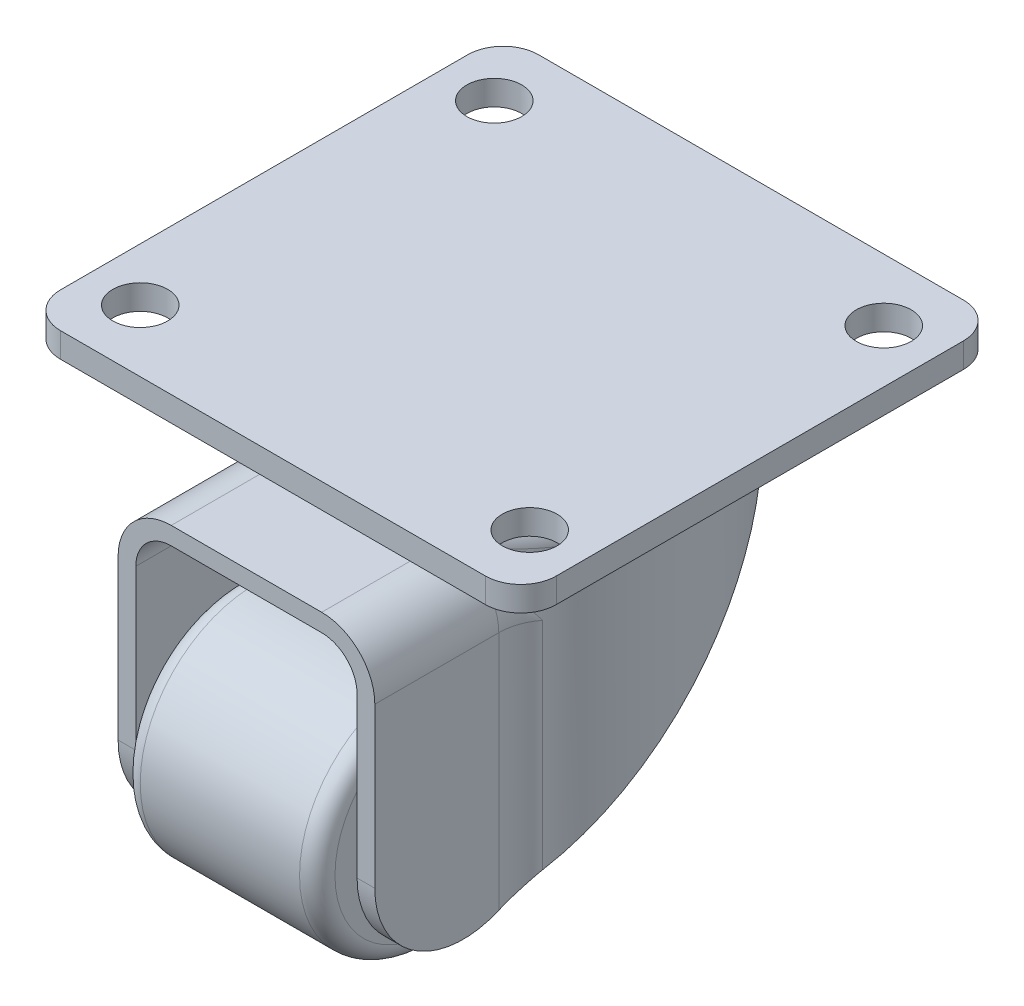
from build123d import *

# Parameters (mm, degrees)
SKETCH1_W               = 28
SKETCH1_H               = 27
BOSS_EXTRUDE1_DEPTH     = 1.4
SKETCH2_R               = 1.55
CUT_EXTRUDE1_DEPTH      = 20.498974332
FILLET1_R               = 2
FILLET2_R               = 2
BOSS_EXTRUDE2_DEPTH     = 20
SKETCH5_W               = 14.5
SKETCH5_H               = 1
BOSS_EXTRUDE3_DEPTH     = 20
FILLET3_R               = 4
FILLET4_R               = 3
CUT_EXTRUDE2_DEPTH      = 32.957002439
CUT_EXTRUDE2_DEPTH_BACK = 32.957002439
FILLET6_R               = 2
FILLET7_R               = 3
SKETCH7_R               = 1.25
BOSS_EXTRUDE4_DEPTH     = 14.5
SKETCH8_R               = 6.5
BOSS_EXTRUDE5_DEPTH     = 5.5
FILLET8_R               = 1


with BuildPart() as part:
    # Sketch1 → Boss-Extrude1 (new body)
    with BuildSketch(Plane(origin=(0, 0, 0), x_dir=(1, 0, 0), z_dir=(0, 1, 0))):
        Rectangle(SKETCH1_W, SKETCH1_H)
    extrude(amount=BOSS_EXTRUDE1_DEPTH)

    # Sketch2 → Cut-Extrude1 (cut, through all)
    with BuildSketch(Plane(origin=(0, 1.4, 0), x_dir=(1, 0, 0), z_dir=(0, 1, 0))):
        with Locations(Location((-11, 10, 0), (0, 0, 270))):
            Circle(SKETCH2_R)
        with Locations(Location((-11, -10, 0), (0, 0, 270))):
            Circle(SKETCH2_R)
        with Locations(Location((11, -10, 0), (0, 0, 270))):
            Circle(SKETCH2_R)
        with Locations(Location((11, 10, 0), (0, 0, 270))):
            Circle(SKETCH2_R)
    extrude(amount=-CUT_EXTRUDE1_DEPTH, mode=Mode.SUBTRACT)

    # Fillet1
    fillet1_edges = [part.edges().sort_by_distance(p)[0] for p in [
        (-14, 0.7, -13.5),
        (14, 0.7, -13.5),
        (14, 0.7, 13.5),
        (-14, 0.7, 13.5),
    ]]
    fillet(fillet1_edges, radius=FILLET1_R)

    # Sketch3 → Revolve1 (revolve)
    with BuildSketch(Plane(origin=(0, 0, 0), x_dir=(0, 0, -1), z_dir=(1, 0, 0)), mode=Mode.PRIVATE) as revolve1_sk:
        Polygon((0, 0), (0, -4.5), (10, -4.5), (10, -2.033813378), (8.767949192, -1), (10.5, 0), align=None)
    revolve(revolve1_sk.sketch.rotate(Axis((0, 0, 0), (0, -1, 0)), 180), axis=Axis((0, 0, 0), (0, -1, 0)))

    # Fillet2
    fillet2_edges = [part.edges().sort_by_distance(p)[0] for p in [
        (0, -2.033813378, -10),
    ]]
    fillet(fillet2_edges, radius=FILLET2_R)

    # Sketch4 → Boss-Extrude2 (add)
    with BuildSketch(Plane.XZ.offset(4.5)):
        with BuildLine():
            Line((-7.25, 15), (-7.25, 6.887488657))
            ThreePointArc((-7.25, 6.887488657), (0, -10), (7.25, 6.887488657))
            Line((7.25, 6.887488657), (7.25, 15))
            Line((7.25, 15), (6.25, 15))
            Line((6.25, 15), (6.25, 6.475916923))
            ThreePointArc((6.25, 6.475916923), (0, -9), (-6.25, 6.475916923))
            Line((-6.25, 6.475916923), (-6.25, 15))
            Line((-6.25, 15), (-7.25, 15))
        make_face()
    extrude(amount=BOSS_EXTRUDE2_DEPTH)

    # Sketch5 → Boss-Extrude3 (add)
    with BuildSketch(Plane.XY.offset(15)):
        with Locations((0, -4)):
            Rectangle(SKETCH5_W, SKETCH5_H)
    extrude(amount=-BOSS_EXTRUDE3_DEPTH)

    # Fillet3
    fillet3_edges = [part.edges().sort_by_distance(p)[0] for p in [
        (6.25, -14.5, 6.475916923),
        (-6.25, -14.5, 6.475916923),
    ]]
    fillet(fillet3_edges, radius=FILLET3_R)

    # Fillet4
    fillet4_edges = [part.edges().sort_by_distance(p)[0] for p in [
        (-7.25, -14, 6.887488657),
        (7.25, -14, 6.887488657),
    ]]
    fillet(fillet4_edges, radius=FILLET4_R)

    # Sketch6 → Cut-Extrude2 (cut, two sides: drawn at the far end of the back side and taken through both)
    with BuildSketch(Plane(origin=(0, 0, 0), x_dir=(0, 0, -1), z_dir=(1, 0, 0)).offset(-CUT_EXTRUDE2_DEPTH_BACK)):
        with BuildLine():
            Line((10, -4.5), (7, -4.5))
            Line((7, -4.5), (-6.331273347, -18.89712301))
            ThreePointArc((-6.331273347, -18.89712301), (-11.824330937, -20.155299844), (-15, -15.5))
            Line((-15, -15.5), (-15, -24.5))
            Line((-15, -24.5), (10, -24.5))
            Line((10, -24.5), (10, -4.5))
        make_face()
    extrude(amount=CUT_EXTRUDE2_DEPTH + CUT_EXTRUDE2_DEPTH_BACK, mode=Mode.SUBTRACT)

    # Fillet6
    # the kernel refuses this fillet: 2 mm, written as the material it adds along each edge
    with BuildSketch(Plane(origin=(0, -4.5, 0), x_dir=(0.7884615384615388, 0, 0.6150840612199793), z_dir=(-0.6150840612199793, 0, 0.7884615384615388))) as fillet6_piece_1_section:
        with BuildLine():
            CenterArc((9 - FILLET6_R, -FILLET6_R), FILLET6_R, 0, 90)
            Line((9, -FILLET6_R), (9, 0))
            Line((9, 0), (9 - FILLET6_R, 0))
        make_face()
    fillet6_piece_1 = revolve(axis=Axis((0, -4.5, 0), (0, 1, 0)), revolution_arc=120.85908443, mode=Mode.PRIVATE)
    fillet6_piece_1 = split(fillet6_piece_1, bisect_by=Plane(origin=(7.790890129, -6.689454566, -4.972635416), z_dir=(0, 0.6794246019412827, 0.7337453306678888)), keep=Keep.TOP, mode=Mode.PRIVATE)
    add(fillet6_piece_1)
    with BuildSketch(Plane(origin=(-6.25, -4.5, 7.996092796), x_dir=(0, -1, 0), z_dir=(0, 0, 1))) as fillet6_piece_2:
        with BuildLine():
            CenterArc((FILLET6_R, FILLET6_R), FILLET6_R, 180, 90)
            Line((0, FILLET6_R), (0, 0))
            Line((0, 0), (FILLET6_R, 0))
        make_face()
    extrude(amount=7.003907204)
    with BuildSketch(Plane(origin=(10.25, -4.5, 7.996092796), x_dir=(-0.7884615384615388, 0, -0.6150840612199795), z_dir=(0.6150840612199795, 0, -0.7884615384615388))) as fillet6_piece_3:
        with BuildLine():
            CenterArc((4 + FILLET6_R, -FILLET6_R), FILLET6_R, 90, 90)
            Line((4, -FILLET6_R), (4, 0))
            Line((4, 0), (4 + FILLET6_R, 0))
        make_face()
    revolve(axis=Axis((10.25, -4.5, 7.996092796), (0, 1, 0)), revolution_arc=37.958028581)
    with BuildSketch(Plane(origin=(-10.25, -4.5, 7.996092796), x_dir=(1, 0, 0), z_dir=(0, 0, 1))) as fillet6_piece_4:
        with BuildLine():
            CenterArc((4 + FILLET6_R, -FILLET6_R), FILLET6_R, 90, 90)
            Line((4 + FILLET6_R, 0), (4, 0))
            Line((4, 0), (4, -FILLET6_R))
        make_face()
    revolve(axis=Axis((-10.25, -4.5, 7.996092796), (0, 1, 0)), revolution_arc=37.958028581)
    with BuildSketch(Plane(origin=(0, -4.5, 0), x_dir=(-0.12358318998339889, 0, -0.9923342154503829), z_dir=(0.9923342154503829, 0, -0.12358318998339889))) as fillet6_piece_5_section:
        with BuildLine():
            CenterArc((9 - FILLET6_R, -FILLET6_R), FILLET6_R, 360, 90)
            Line((9 - FILLET6_R, 0), (9, 0))
            Line((9, 0), (9, -FILLET6_R))
        make_face()
    fillet6_piece_5 = revolve(axis=Axis((0, -4.5, 0), (0, 1, 0)), revolution_arc=120.85908443, mode=Mode.PRIVATE)
    fillet6_piece_5 = split(fillet6_piece_5, bisect_by=Plane(origin=(-7.79089013, -6.689454565, -4.972635417), z_dir=(0, 0.6794246019412827, 0.7337453306678888)), keep=Keep.TOP, mode=Mode.PRIVATE)
    add(fillet6_piece_5)
    with BuildSketch(Plane(origin=(6.25, -4.5, 15), x_dir=(-1, 0, 0), z_dir=(0, 0, -1))) as fillet6_piece_6:
        with BuildLine():
            CenterArc((FILLET6_R, -FILLET6_R), FILLET6_R, 90, 90)
            Line((0, -FILLET6_R), (0, 0))
            Line((0, 0), (FILLET6_R, 0))
        make_face()
    extrude(amount=7.003907204)

    # Fillet7
    # the kernel refuses this fillet: 3 mm, written as the material it takes off along each edge
    with BuildSketch(Plane(origin=(7.25, -3.5, 22.5), x_dir=(-1, 0, 0), z_dir=(0, 0, -1))) as fillet7_piece_1_section:
        with BuildLine():
            CenterArc((FILLET7_R, -FILLET7_R), FILLET7_R, 90, 90)
            Line((0, -FILLET7_R), (0, 0))
            Line((0, 0), (FILLET7_R, 0))
        make_face()
    fillet7_piece_1 = extrude(amount=14.503907204, mode=Mode.PRIVATE)
    fillet7_piece_1 = fillet7_piece_1 - Plane(origin=(0, -4.174011866, 0), x_dir=(0, 0, 1), z_dir=(0, 1, 0)) * Cylinder(10, 42, mode=Mode.PRIVATE)
    add(fillet7_piece_1, mode=Mode.SUBTRACT)
    with BuildSketch(Plane(origin=(-7.25, -3.5, 22.5), x_dir=(0, -1, 0), z_dir=(0, 0, -1))) as fillet7_piece_2_section:
        with BuildLine():
            CenterArc((FILLET7_R, -FILLET7_R), FILLET7_R, 90, 90)
            Line((0, -FILLET7_R), (0, 0))
            Line((0, 0), (FILLET7_R, 0))
        make_face()
    fillet7_piece_2 = extrude(amount=14.503907204, mode=Mode.PRIVATE)
    fillet7_piece_2 = fillet7_piece_2 - Plane(origin=(0, -4.174011864, 0), x_dir=(0, 0, 1), z_dir=(0, 1, 0)) * Cylinder(10, 42, mode=Mode.PRIVATE)
    add(fillet7_piece_2, mode=Mode.SUBTRACT)
    with BuildSketch(Plane(origin=(10.25, -3.5, 7.996092796), x_dir=(0.999777856242507, 0, 0.021076958204088978), z_dir=(-0.021076958204088978, 0, 0.999777856242507))) as fillet7_piece_3_section:
        with BuildLine():
            CenterArc((3 + FILLET7_R, -FILLET7_R), FILLET7_R, 90, 90)
            Line((3, -FILLET7_R), (3, 0))
            Line((3, 0), (3 + FILLET7_R, 0))
        make_face()
    fillet7_piece_3 = revolve(axis=Axis((10.25, -3.5, 7.996092796), (0, 1, 0)), revolution_arc=181.20771018, mode=Mode.PRIVATE)
    fillet7_piece_3 = fillet7_piece_3 - Plane(origin=(0, -4.740784246, 0), x_dir=(0, 0, 1), z_dir=(0, 1, 0)) * Cylinder(10, 25, mode=Mode.PRIVATE)
    add(fillet7_piece_3, mode=Mode.SUBTRACT)
    with BuildSketch(Plane(origin=(-10.25, -3.5, 7.996092796), x_dir=(1, 0, 0), z_dir=(0, 0, 1))) as fillet7_piece_4_section:
        with BuildLine():
            CenterArc((3 + FILLET7_R, -FILLET7_R), FILLET7_R, 90, 90)
            Line((3, -FILLET7_R), (3, 0))
            Line((3, 0), (3 + FILLET7_R, 0))
        make_face()
    fillet7_piece_4 = revolve(axis=Axis((-10.25, -3.5, 7.996092796), (0, 1, 0)), revolution_arc=181.20771018, mode=Mode.PRIVATE)
    fillet7_piece_4 = fillet7_piece_4 - Plane(origin=(0, -4.344779192, 0), x_dir=(0, 0, 1), z_dir=(0, 1, 0)) * Cylinder(10, 24, mode=Mode.PRIVATE)
    add(fillet7_piece_4, mode=Mode.SUBTRACT)

    # Sketch7 → Boss-Extrude4 (add)
    with BuildSketch(Plane.ZY.offset(7.25)):
        with Locations((10, -15.5)):
            Circle(SKETCH7_R)
    extrude(amount=-BOSS_EXTRUDE4_DEPTH)

    # Sketch8 → Boss-Extrude5 (add, symmetric)
    with BuildSketch(Plane(origin=(0, 0, 0), x_dir=(0, 0, -1), z_dir=(1, 0, 0))):
        with Locations((-10, -15.5)):
            Circle(SKETCH8_R)
    extrude(amount=BOSS_EXTRUDE5_DEPTH, both=True)

    # Fillet8
    fillet8_edges = [part.edges().sort_by_distance(p)[0] for p in [
        (-5.5, -15.5, 16.5),
        (5.5, -15.5, 16.5),
    ]]
    fillet(fillet8_edges, radius=FILLET8_R)


solid = part.part
